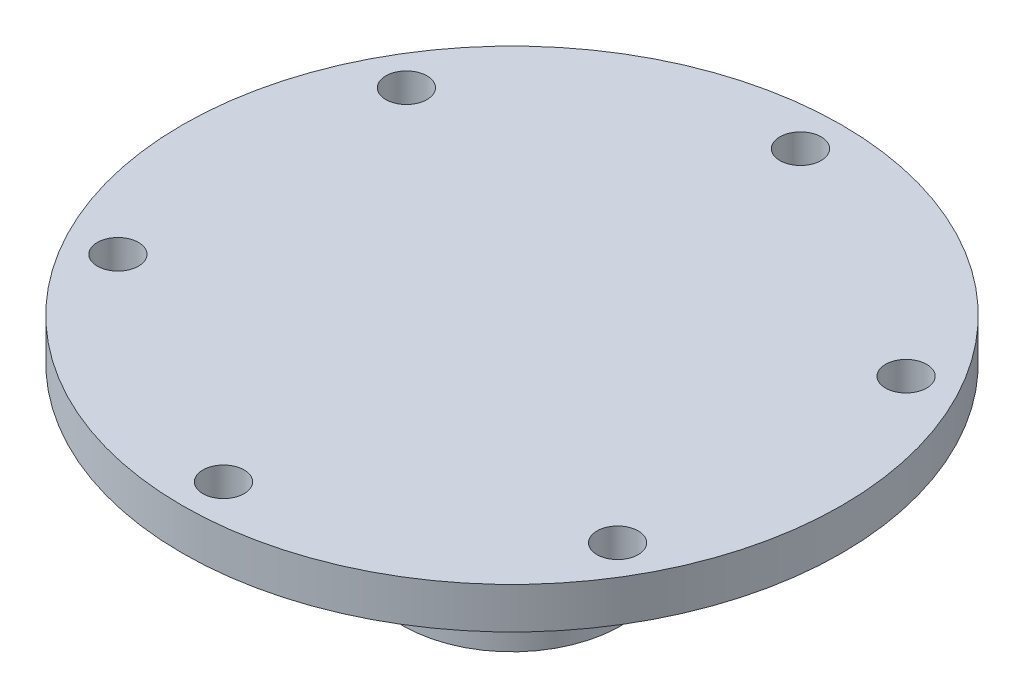
from build123d import *

# Parameters (mm, degrees)
SKETCH1_R                   = 20.32
CYLINDER_DEPTH              = 14.478
SKETCH2_W                   = 7.62
SKETCH2_H                   = 11.938
SKETCH3_W                   = 2.286
SKETCH3_H                   = 2.794
SKETCH4_W                   = 5.969
SKETCH4_H                   = 6.604
SKETCH5_W                   = 2.286
SKETCH5_H                   = 2.794
BOTTOM_CHAMFER_SIZE         = 6.731
BOTTOM_CHAMFER_SIZE2        = 1.27
MOUNTING_HOLE_REACH         = 34.178
SKETCH6_R                   = 1.27
MOUNTING_HOLE_PATTERN_COUNT = 6


with BuildPart() as part:
    # Sketch1 → Cylinder (new body)
    with BuildSketch(Plane(origin=(0, 0, 0), x_dir=(1, 0, 0), z_dir=(0, 1, 0))):
        Circle(SKETCH1_R)
    extrude(amount=CYLINDER_DEPTH)

    # Sketch2 → Mid O Ring Wings (revolve, cut)
    with BuildSketch(Plane.XY):
        with Locations((16.51, 5.969)):
            Rectangle(SKETCH2_W, SKETCH2_H)
    revolve(axis=Axis((0, 21.496286204, 0), (0, -1, 0)), mode=Mode.SUBTRACT)

    # Sketch3 → Mid O Ring Cut (revolve, cut)
    with BuildSketch(Plane.XY):
        with Locations((11.557, 9.271)):
            Rectangle(SKETCH3_W, SKETCH3_H)
    revolve(axis=Axis((0, 21.496286204, 0), (0, -1, 0)), mode=Mode.SUBTRACT)

    # Sketch4 → Bottom O Ring Wings (revolve, cut)
    with BuildSketch(Plane.XY):
        with Locations((9.7155, 3.302)):
            Rectangle(SKETCH4_W, SKETCH4_H)
    revolve(axis=Axis((0, 21.496286204, 0), (0, -1, 0)), mode=Mode.SUBTRACT)

    # Sketch5 → Bottom O Ring Cut (revolve, cut)
    with BuildSketch(Plane.XY):
        with Locations((5.588, 3.937)):
            Rectangle(SKETCH5_W, SKETCH5_H)
    revolve(axis=Axis((0, 21.496286204, 0), (0, -1, 0)), mode=Mode.SUBTRACT)

    # Bottom Chamfer
    bottom_chamfer_edges = [part.edges().sort_by_distance(p)[0] for p in [
        (-6.731, 0, 0),
    ]]
    bottom_chamfer_side = [part.faces().sort_by_distance(p)[0] for p in [
        (0, 0, 0),
    ]]
    chamfer(bottom_chamfer_edges, length=BOTTOM_CHAMFER_SIZE, length2=BOTTOM_CHAMFER_SIZE2, reference=bottom_chamfer_side[0])

    # Sketch6 → Mounting Hole (cut, up to next)
    with BuildSketch(Plane(origin=(0, 14.478, 0), x_dir=(1, 0, 0), z_dir=(0, 1, 0)), mode=Mode.PRIVATE) as mounting_hole_sk1:
        with Locations((0, 17.78)):
            Circle(SKETCH6_R)
    mounting_hole_tool1 = extrude(mounting_hole_sk1.sketch, amount=-MOUNTING_HOLE_REACH, mode=Mode.PRIVATE) & part.part
    mounting_hole = mounting_hole_tool1.solids().sort_by_distance((0, 14.478, -17.78))[0]
    add(mounting_hole, mode=Mode.SUBTRACT)

    # Mounting Hole Pattern: Mounting Hole ×6 about axis
    mounting_hole_pattern_axis = Axis((0, 14.478, 0), (0, 1, 0))
    for i in range(1, MOUNTING_HOLE_PATTERN_COUNT):
        add(mounting_hole.rotate(mounting_hole_pattern_axis, i * 360 / MOUNTING_HOLE_PATTERN_COUNT), mode=Mode.SUBTRACT)


solid = part.part
